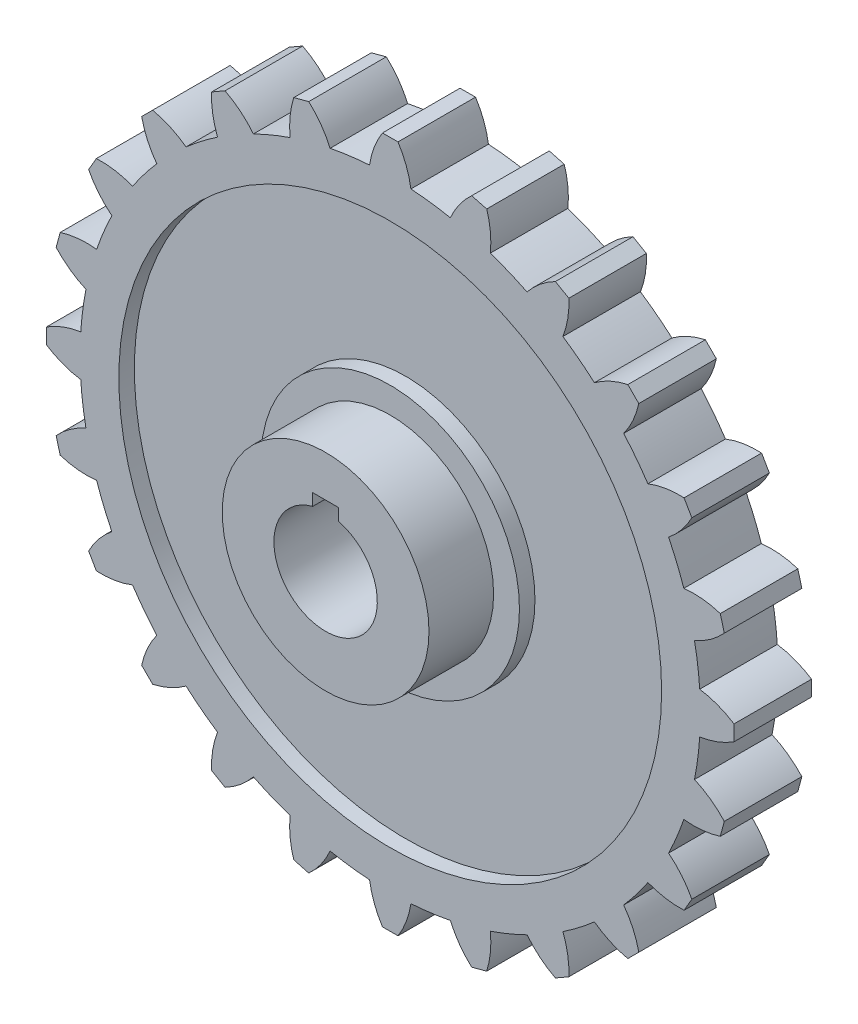
from build123d import *

# Parameters (mm, degrees)
SKETCH1_R           = 60
BOSS_EXTRUDE1_DEPTH = 7.5
BOSS_EXTRUDE2_DEPTH = 15
CIRPATTERN1_START   = -7.5
CIRPATTERN1_DEPTH   = 15
SKETCH3_R           = 20
BOSS_EXTRUDE3_DEPTH = 20
CUT_EXTRUDE1_DEPTH  = 103.198336581
CUT_EXTRUDE4_START  = -7.5
SKETCH5_R           = 52.5
SKETCH5_R_2         = 25
CUT_EXTRUDE4_DEPTH  = 3


# Read off the part's stored shape, not the designer's step: CirPattern1
with BuildPart() as part:
    # Sketch1 → Boss-Extrude1 (new, symmetric)
    with BuildSketch(Plane.XY):
        Circle(SKETCH1_R)
    extrude(amount=BOSS_EXTRUDE1_DEPTH, both=True)

    # Sketch2 → Boss-Extrude2 (add)
    with BuildSketch(Plane.XY.offset(7.5)):
        with BuildLine():
            Line((0, 66.5), (0, 60))
            ThreePointArc((0, 60), (2.001113277, 59.966620262), (4, 59.866518188))
            ThreePointArc((4, 59.866518188), (3.099609074, 63.315018359), (1.5, 66.5))
            Line((1.5, 66.5), (0, 66.5))
        make_face()
        with BuildLine():
            ThreePointArc((-4, 59.866518188), (-2.001113277, 59.966620262), (0, 60))
            Line((0, 60), (0, 66.5))
            Line((0, 66.5), (-1.5, 66.5))
            ThreePointArc((-1.5, 66.5), (-3.099609074, 63.315018359), (-4, 59.866518188))
        make_face()
    extrude(amount=-BOSS_EXTRUDE2_DEPTH)

    # CirPattern1 outline → CirPattern1 (add)
    with BuildSketch(Plane.XY.offset(CIRPATTERN1_START)):
        with BuildLine():
            ThreePointArc((-18.660355239, 63.845838881), (-19.381125049, 60.355373564), (-19.358298376, 56.791339868))
            ThreePointArc((-19.358298376, 56.791339868), (-15.529142706, 57.955549577), (-11.630891766, 58.861892228))
            ThreePointArc((-11.630891766, 58.861892228), (-13.393140136, 61.959849286), (-15.76257776, 64.622296016))
            Line((-15.76257776, 64.622296016), (-18.660355239, 63.845838881))
        make_face()
        with BuildLine():
            ThreePointArc((-34.549038106, 56.840689352), (-34.34184938, 53.282609803), (-33.397360709, 49.845925587))
            ThreePointArc((-33.397360709, 49.845925587), (-30, 51.961524227), (-26.469157479, 53.845925587))
            ThreePointArc((-26.469157479, 53.845925587), (-28.973168979, 56.382218877), (-31.950961894, 58.340689352))
            Line((-31.950961894, 58.340689352), (-34.549038106, 56.840689352))
        make_face()
        with BuildLine():
            ThreePointArc((-48.083261121, 45.961940777), (-46.962233428, 42.578724237), (-45.160448102, 39.503593852))
            ThreePointArc((-45.160448102, 39.503593852), (-42.426406871, 42.426406871), (-39.503593852, 45.160448102))
            ThreePointArc((-39.503593852, 45.160448102), (-42.578724237, 46.962233428), (-45.961940777, 48.083261121))
            Line((-45.961940777, 48.083261121), (-48.083261121, 45.961940777))
        make_face()
        with BuildLine():
            ThreePointArc((-58.340689352, 31.950961894), (-56.382218877, 28.973168979), (-53.845925587, 26.469157479))
            ThreePointArc((-53.845925587, 26.469157479), (-51.961524227, 30), (-49.845925587, 33.397360709))
            ThreePointArc((-49.845925587, 33.397360709), (-53.282609803, 34.34184938), (-56.840689352, 34.549038106))
            Line((-56.840689352, 34.549038106), (-58.340689352, 31.950961894))
        make_face()
        with BuildLine():
            ThreePointArc((-64.622296016, 15.76257776), (-61.959849286, 13.393140136), (-58.861892229, 11.630891766))
            ThreePointArc((-58.861892229, 11.630891766), (-57.955549577, 15.529142706), (-56.791339868, 19.358298376))
            ThreePointArc((-56.791339868, 19.358298376), (-60.355373564, 19.381125049), (-63.845838881, 18.660355239))
            Line((-63.845838881, 18.660355239), (-64.622296016, 15.76257776))
        make_face()
        with BuildLine():
            ThreePointArc((-66.5, -1.5), (-63.315018359, -3.099609074), (-59.866518188, -4))
            ThreePointArc((-59.866518188, -4), (-60, 0), (-59.866518188, 4))
            ThreePointArc((-59.866518188, 4), (-63.315018359, 3.099609074), (-66.5, 1.5))
            Line((-66.5, 1.5), (-66.5, -1.5))
        make_face()
        with BuildLine():
            ThreePointArc((-63.845838881, -18.660355239), (-60.355373564, -19.381125049), (-56.791339868, -19.358298376))
            ThreePointArc((-56.791339868, -19.358298376), (-57.955549577, -15.529142706), (-58.861892228, -11.630891766))
            ThreePointArc((-58.861892228, -11.630891766), (-61.959849286, -13.393140136), (-64.622296016, -15.76257776))
            Line((-64.622296016, -15.76257776), (-63.845838881, -18.660355239))
        make_face()
        with BuildLine():
            ThreePointArc((-56.840689352, -34.549038106), (-53.282609803, -34.34184938), (-49.845925587, -33.397360709))
            ThreePointArc((-49.845925587, -33.397360709), (-51.961524227, -30), (-53.845925587, -26.469157479))
            ThreePointArc((-53.845925587, -26.469157479), (-56.382218877, -28.973168979), (-58.340689352, -31.950961894))
            Line((-58.340689352, -31.950961894), (-56.840689352, -34.549038106))
        make_face()
        with BuildLine():
            ThreePointArc((-45.961940777, -48.083261121), (-42.578724237, -46.962233428), (-39.503593852, -45.160448102))
            ThreePointArc((-39.503593852, -45.160448102), (-42.426406871, -42.426406871), (-45.160448102, -39.503593852))
            ThreePointArc((-45.160448102, -39.503593852), (-46.962233428, -42.578724237), (-48.083261121, -45.961940777))
            Line((-48.083261121, -45.961940777), (-45.961940777, -48.083261121))
        make_face()
        with BuildLine():
            ThreePointArc((-31.950961894, -58.340689352), (-28.973168979, -56.382218877), (-26.469157479, -53.845925587))
            ThreePointArc((-26.469157479, -53.845925587), (-30, -51.961524227), (-33.397360709, -49.845925587))
            ThreePointArc((-33.397360709, -49.845925587), (-34.34184938, -53.282609803), (-34.549038106, -56.840689352))
            Line((-34.549038106, -56.840689352), (-31.950961894, -58.340689352))
        make_face()
        with BuildLine():
            ThreePointArc((-15.76257776, -64.622296016), (-13.393140136, -61.959849286), (-11.630891766, -58.861892229))
            ThreePointArc((-11.630891766, -58.861892229), (-15.529142706, -57.955549577), (-19.358298376, -56.791339868))
            ThreePointArc((-19.358298376, -56.791339868), (-19.381125049, -60.355373564), (-18.660355239, -63.845838881))
            Line((-18.660355239, -63.845838881), (-15.76257776, -64.622296016))
        make_face()
        with BuildLine():
            ThreePointArc((1.5, -66.5), (3.099609074, -63.315018359), (4, -59.866518188))
            ThreePointArc((4, -59.866518188), (0, -60), (-4, -59.866518188))
            ThreePointArc((-4, -59.866518188), (-3.099609074, -63.315018359), (-1.5, -66.5))
            Line((-1.5, -66.5), (1.5, -66.5))
        make_face()
        with BuildLine():
            ThreePointArc((18.660355239, -63.845838881), (19.381125049, -60.355373564), (19.358298376, -56.791339868))
            ThreePointArc((19.358298376, -56.791339868), (15.529142706, -57.955549577), (11.630891766, -58.861892229))
            ThreePointArc((11.630891766, -58.861892229), (13.393140136, -61.959849286), (15.76257776, -64.622296016))
            Line((15.76257776, -64.622296016), (18.660355239, -63.845838881))
        make_face()
        with BuildLine():
            ThreePointArc((34.549038106, -56.840689352), (34.34184938, -53.282609803), (33.397360709, -49.845925587))
            ThreePointArc((33.397360709, -49.845925587), (30, -51.961524227), (26.469157479, -53.845925587))
            ThreePointArc((26.469157479, -53.845925587), (28.973168979, -56.382218877), (31.950961894, -58.340689352))
            Line((31.950961894, -58.340689352), (34.549038106, -56.840689352))
        make_face()
        with BuildLine():
            ThreePointArc((48.083261121, -45.961940777), (46.962233428, -42.578724237), (45.160448102, -39.503593852))
            ThreePointArc((45.160448102, -39.503593852), (42.426406871, -42.426406871), (39.503593852, -45.160448102))
            ThreePointArc((39.503593852, -45.160448102), (42.578724237, -46.962233428), (45.961940777, -48.083261121))
            Line((45.961940777, -48.083261121), (48.083261121, -45.961940777))
        make_face()
        with BuildLine():
            ThreePointArc((58.340689352, -31.950961894), (56.382218877, -28.973168979), (53.845925587, -26.469157479))
            ThreePointArc((53.845925587, -26.469157479), (51.961524227, -30), (49.845925587, -33.397360709))
            ThreePointArc((49.845925587, -33.397360709), (53.282609803, -34.34184938), (56.840689352, -34.549038106))
            Line((56.840689352, -34.549038106), (58.340689352, -31.950961894))
        make_face()
        with BuildLine():
            ThreePointArc((64.622296016, -15.76257776), (61.959849286, -13.393140136), (58.861892229, -11.630891766))
            ThreePointArc((58.861892229, -11.630891766), (57.955549577, -15.529142706), (56.791339868, -19.358298376))
            ThreePointArc((56.791339868, -19.358298376), (60.355373564, -19.381125049), (63.845838881, -18.660355239))
            Line((63.845838881, -18.660355239), (64.622296016, -15.76257776))
        make_face()
        with BuildLine():
            ThreePointArc((66.5, 1.5), (63.315018359, 3.099609074), (59.866518188, 4))
            ThreePointArc((59.866518188, 4), (60, 0), (59.866518188, -4))
            ThreePointArc((59.866518188, -4), (63.315018359, -3.099609074), (66.5, -1.5))
            Line((66.5, -1.5), (66.5, 1.5))
        make_face()
        with BuildLine():
            ThreePointArc((63.845838881, 18.660355239), (60.355373564, 19.381125049), (56.791339868, 19.358298376))
            ThreePointArc((56.791339868, 19.358298376), (57.955549577, 15.529142706), (58.861892228, 11.630891766))
            ThreePointArc((58.861892228, 11.630891766), (61.959849286, 13.393140136), (64.622296016, 15.76257776))
            Line((64.622296016, 15.76257776), (63.845838881, 18.660355239))
        make_face()
        with BuildLine():
            ThreePointArc((56.840689352, 34.549038106), (53.282609803, 34.34184938), (49.845925587, 33.397360709))
            ThreePointArc((49.845925587, 33.397360709), (51.961524227, 30), (53.845925587, 26.469157479))
            ThreePointArc((53.845925587, 26.469157479), (56.382218877, 28.973168979), (58.340689352, 31.950961894))
            Line((58.340689352, 31.950961894), (56.840689352, 34.549038106))
        make_face()
        with BuildLine():
            ThreePointArc((45.961940777, 48.083261121), (42.578724237, 46.962233428), (39.503593852, 45.160448102))
            ThreePointArc((39.503593852, 45.160448102), (42.426406871, 42.426406871), (45.160448102, 39.503593852))
            ThreePointArc((45.160448102, 39.503593852), (46.962233428, 42.578724237), (48.083261121, 45.961940777))
            Line((48.083261121, 45.961940777), (45.961940777, 48.083261121))
        make_face()
        with BuildLine():
            ThreePointArc((31.950961894, 58.340689352), (28.973168979, 56.382218877), (26.469157479, 53.845925587))
            ThreePointArc((26.469157479, 53.845925587), (30, 51.961524227), (33.397360709, 49.845925587))
            ThreePointArc((33.397360709, 49.845925587), (34.34184938, 53.282609803), (34.549038106, 56.840689352))
            Line((34.549038106, 56.840689352), (31.950961894, 58.340689352))
        make_face()
        with BuildLine():
            Line((18.660355239, 63.845838881), (15.76257776, 64.622296016))
            ThreePointArc((15.76257776, 64.622296016), (13.393140136, 61.959849286), (11.630891766, 58.861892229))
            ThreePointArc((11.630891766, 58.861892229), (15.529142706, 57.955549577), (19.358298376, 56.791339868))
            ThreePointArc((19.358298376, 56.791339868), (19.381125049, 60.355373564), (18.660355239, 63.845838881))
        make_face()
    extrude(amount=CIRPATTERN1_DEPTH)

    # Sketch3 → Boss-Extrude3 (add, symmetric)
    with BuildSketch(Plane.XY):
        Circle(SKETCH3_R)
    extrude(amount=BOSS_EXTRUDE3_DEPTH, both=True)

    # Sketch4 → Cut-Extrude1 (cut, through all)
    with BuildSketch(Plane(origin=(0, 0, -20), x_dir=(-1, 0, 0), z_dir=(0, 0, -1))):
        with BuildLine():
            Line((-2.5, 9.682458366), (-2.5, 12))
            Line((-2.5, 12), (2.5, 12))
            Line((2.5, 12), (2.5, 9.682458366))
            ThreePointArc((2.5, 9.682458366), (0, -10), (-2.5, 9.682458366))
        make_face()
    extrude(amount=-CUT_EXTRUDE1_DEPTH, mode=Mode.SUBTRACT)

    # Sketch5 → Cut-Extrude4 (cut)
    with BuildSketch(Plane.XY.offset(CUT_EXTRUDE4_START)):
        Circle(SKETCH5_R)
        Circle(SKETCH5_R_2, mode=Mode.SUBTRACT)
    cut_extrude4 = extrude(amount=CUT_EXTRUDE4_DEPTH, mode=Mode.SUBTRACT)

    # Mirror3: Cut-Extrude4 across plane
    add(cut_extrude4.mirror(Plane.XY), mode=Mode.SUBTRACT)


solid = part.part
